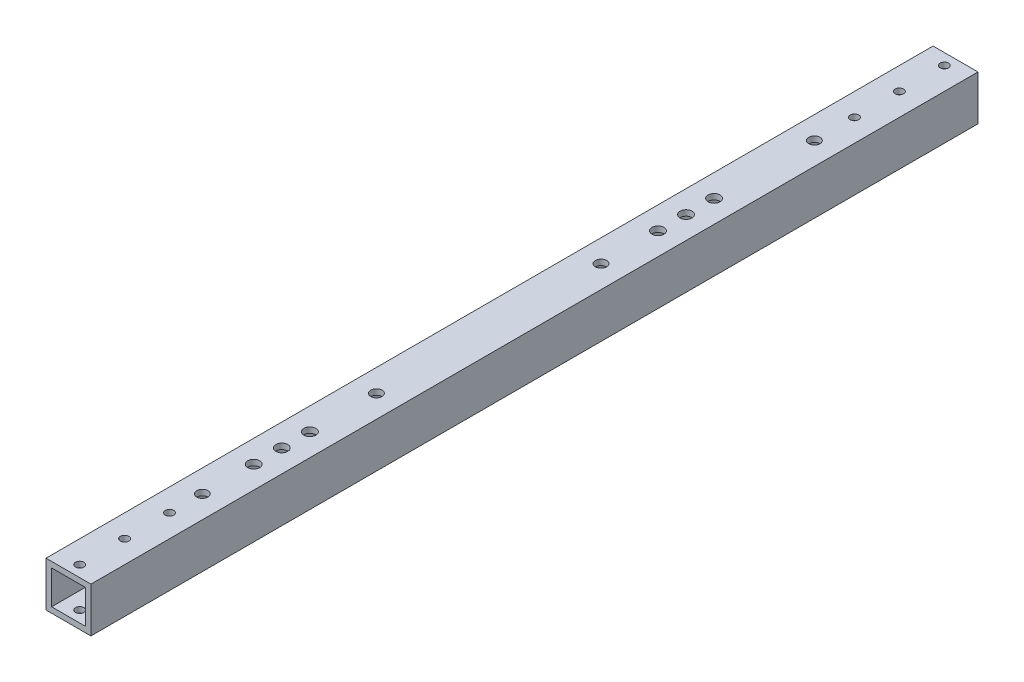
from build123d import *

# Parameters (mm, degrees)
SKETCH1_W                       = 25.4
SKETCH1_H                       = 25.4
SKETCH1_W_2                     = 19.05
SKETCH1_H_2                     = 19.05
EXTRUDE_THIN1_DEPTH             = 501.65
F_3_16_0_1875_DIAMETER_HOLE1_D  = 4.7625
F_1_4_0_25_DIAMETER_HOLE1_D     = 6.35
F_1_4_0_25_DIAMETER_HOLE1_DEPTH = 25.4
F_1_4_0_25_DIAMETER_HOLE1_TIP   = 1.907732465
F_1_4_CLEARANCE_HOLE1_D         = 6.7564
F_1_4_CLEARANCE_HOLE1_DEPTH     = 38.1
F_1_4_CLEARANCE_HOLE1_TIP       = 2.029827343


with BuildPart() as part:
    # Sketch1 → Extrude-Thin1 (new body)
    with BuildSketch(Plane.XY):
        Rectangle(SKETCH1_W, SKETCH1_H)
        Rectangle(SKETCH1_W_2, SKETCH1_H_2, mode=Mode.SUBTRACT)
    extrude(amount=EXTRUDE_THIN1_DEPTH)

    # 3/16 (0.1875) Diameter Hole1 (through all)
    with Locations(Plane(origin=(0, 12.7, 495.3), x_dir=(0, 0, 1), z_dir=(0, 1, 0))):
        with Locations((0, 0), (-488.95, 0), (-463.55, 0), (-438.15, 0), (-25.4, 0), (-50.8, 0)):
            Hole(F_3_16_0_1875_DIAMETER_HOLE1_D / 2)

    # 1/4 (0.25) Diameter Hole1
    with Locations(Plane(origin=(0, 12.7, 0), x_dir=(1, 0, 0), z_dir=(0, 1, 0))):
        with Locations((0, -79.831), (0, -425.933853021), (0, -327.499040355), (0, -200.481)):
            Hole(F_1_4_0_25_DIAMETER_HOLE1_D / 2, depth=F_1_4_0_25_DIAMETER_HOLE1_DEPTH)
            with Locations((0, 0, -(F_1_4_0_25_DIAMETER_HOLE1_DEPTH + F_1_4_0_25_DIAMETER_HOLE1_TIP / 2))):  # 118° drill point
                Cone(0, F_1_4_0_25_DIAMETER_HOLE1_D / 2, F_1_4_0_25_DIAMETER_HOLE1_TIP, mode=Mode.SUBTRACT)

    # 1/4 Clearance Hole1
    with Locations(Plane(origin=(381, 25.4, 250.825), x_dir=(1, 0, 0), z_dir=(0, 1, 0))):
        with Locations((381, 82.55), (381, 98.425), (381, 114.3), (381, -146.05), (381, -130.175), (381, -114.3), (-381, -146.05), (-381, -130.175), (-381, -114.3), (-381, 82.55), (-381, 98.425), (-381, 114.3)):
            Hole(F_1_4_CLEARANCE_HOLE1_D / 2, depth=F_1_4_CLEARANCE_HOLE1_DEPTH)
            with Locations((0, 0, -(F_1_4_CLEARANCE_HOLE1_DEPTH + F_1_4_CLEARANCE_HOLE1_TIP / 2))):  # 118° drill point
                Cone(0, F_1_4_CLEARANCE_HOLE1_D / 2, F_1_4_CLEARANCE_HOLE1_TIP, mode=Mode.SUBTRACT)


solid = part.part
